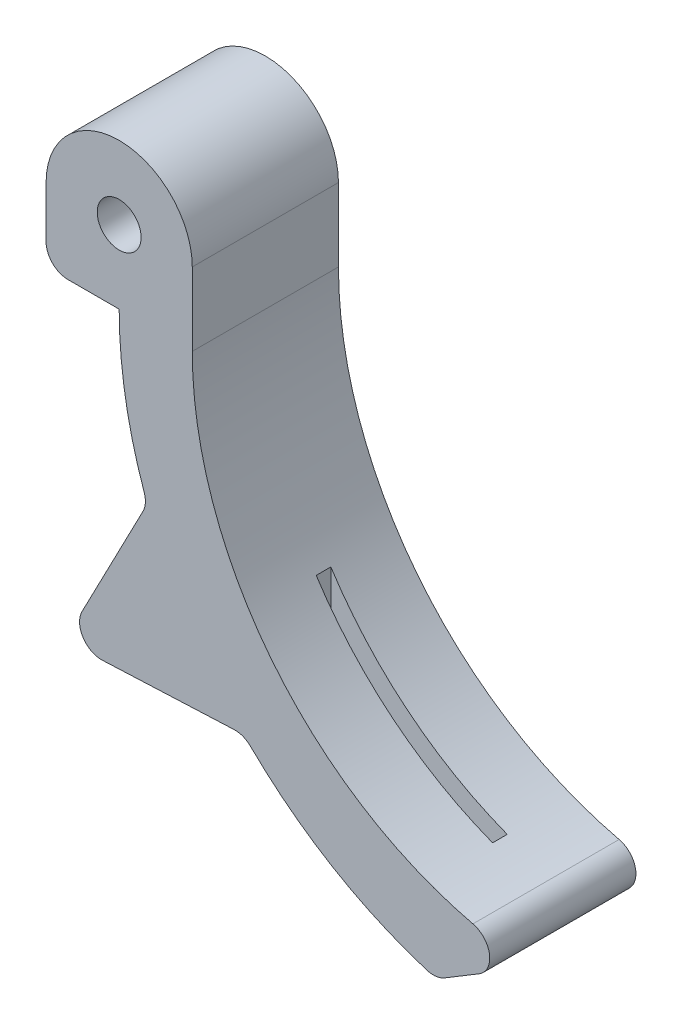
from build123d import *

# Parameters (mm, degrees)
SKETCH_2_R              = 1.5
EXTRUDE_1_DEPTH         = 10
FILLET_1_R              = 1.5
CUT_EXTRUDE_START       = 8.978636738
CUT_EXTRUDE_6_OUTLINE_W = 18
CUT_EXTRUDE_6_OUTLINE_H = 1
CUT_EXTRUDE_6_DEPTH     = 12.065744551


# Read off the part's stored shape, not the designer's step: 切除-拉伸6
with BuildPart() as part:
    # 草图2 → 凸台-拉伸1 (new body)
    with BuildSketch(Plane.XY):
        with BuildLine():
            Line((-3.738313135, -26.487804482), (8.522639585, -25.945713856))
            ThreePointArc((8.522639585, -25.945713856), (14.597644225, -30.744268797), (21.698305683, -33.828489568))
            Line((21.698305683, -33.828489568), (28.148131868, -29.931317342))
            ThreePointArc((28.148131868, -29.931317342), (11.679291726, -22.010339454), (5, -5))
            Line((5, -5), (5, 0))
            ThreePointArc((5, 0), (0, 5), (-5, 0))
            Line((-5, 0), (-5, -5))
            Line((-5, -5), (1.011e-06, -5))
            ThreePointArc((1.011e-06, -5), (0.486326168, -10.379869542), (1.929534162, -15.585314685))
            Line((1.929534162, -15.585314685), (-3.738313135, -26.487804482))
        make_face()
        Circle(SKETCH_2_R, mode=Mode.SUBTRACT)
    extrude(amount=EXTRUDE_1_DEPTH)

    # 圆角1
    fillet_1_edges = [part.edges().sort_by_distance(p)[0] for p in [
        (-3.738313135, -26.487804482, 5),
        (1.929534162, -15.585314685, 5),
        (-5, -5, 5),
        (28.148131868, -29.931317342, 5),
        (21.698305683, -33.828489568, 5),
        (8.522639585, -25.945713856, 5),
    ]]
    fillet(fillet_1_edges, radius=FILLET_1_R)

    # 切除-拉伸6 outline → 切除-拉伸6 (cut)
    with BuildSketch(Plane.YZ.offset(CUT_EXTRUDE_START)):
        with Locations((-26, 5)):
            Rectangle(CUT_EXTRUDE_6_OUTLINE_W, CUT_EXTRUDE_6_OUTLINE_H)
    extrude(amount=CUT_EXTRUDE_6_DEPTH, mode=Mode.SUBTRACT)


solid = part.part
